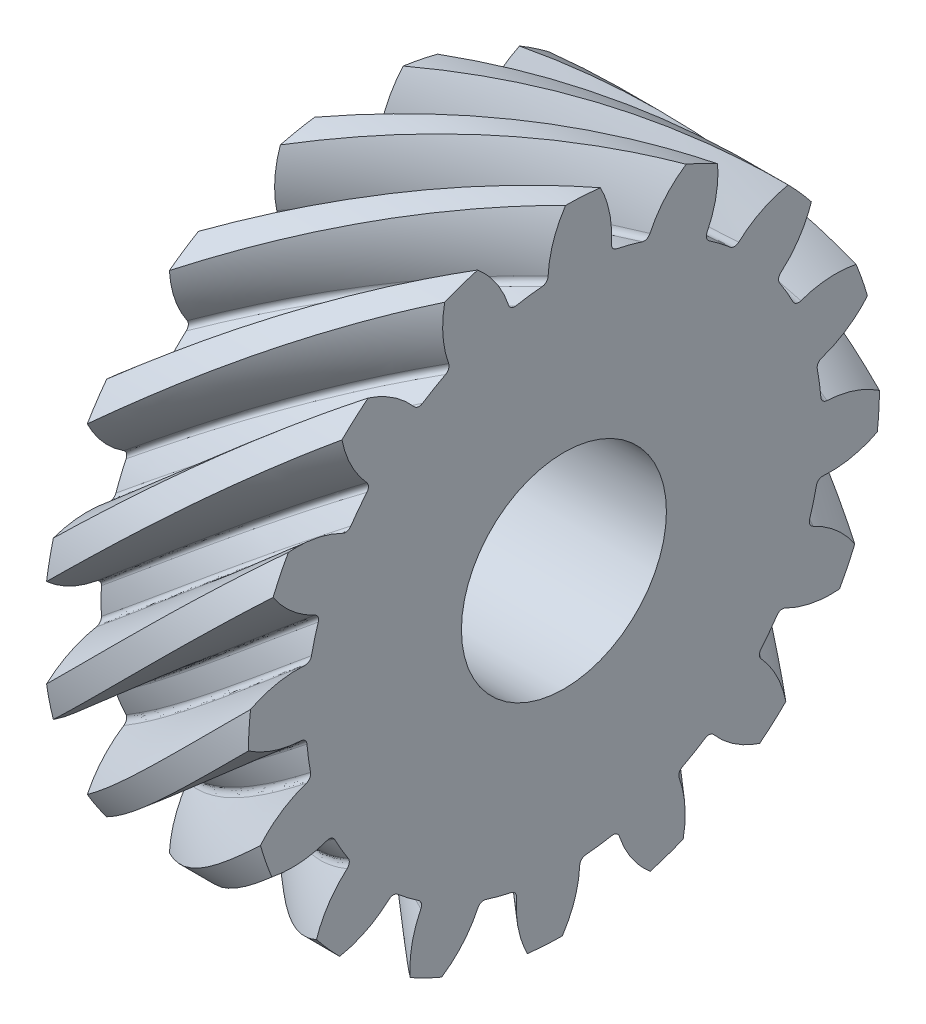
from build123d import *

# Parameters (mm, degrees)
BASPROSKE_W            = 12.7
BASPROSKE_H            = 19.548012242
TOOTHCUTLH_PITCH       = 122.823783304
TOOTHCUTLH_HEIGHT      = 12.7
TOOTHCUTLH_RADIUS      = 19.548012242
TOOTHCUTLH_START_ANGLE = -90
TEETHCUTSLH_COUNT      = 16
TEETHCUTSLH_ANGLE      = 337.5
BORSKE_R               = 6.35
BORE_DEPTH             = 50.8000508


with BuildPart() as part:
    # BasProSke → Base-Revolve (revolve)
    with BuildSketch(Plane(origin=(0, 0, 0), x_dir=(1, 0, 0), z_dir=(0, 1, 0)), mode=Mode.PRIVATE) as base_revolve_sk:
        with Locations((6.35, 9.774006121)):
            Rectangle(BASPROSKE_W, BASPROSKE_H)
    revolve(base_revolve_sk.sketch.rotate(Axis((-10, 0, 0), (1, 0, 0)), 180), axis=Axis((-10, 0, 0), (1, 0, 0)))

    # ToothCutLH: sweep along a helix
    with BuildLine() as toothcutlh_path:
        add(Helix(TOOTHCUTLH_PITCH, TOOTHCUTLH_HEIGHT, TOOTHCUTLH_RADIUS, center=(0, 0, 0), direction=(1, 0, 0), lefthand=True, mode=Mode.PRIVATE).rotate(Axis((0, 0, 0), (1, 0, 0)), TOOTHCUTLH_START_ANGLE))
    # TooCutSkeRH<3> → ToothCutLH (sweep, cut)
    with BuildSketch(Plane(origin=(0, 0, 0), x_dir=(0, 0, -1), z_dir=(1, 0, 0))):
        with BuildLine():
            ThreePointArc((0.823755872, 15.954886005), (0, 15.976137242), (-0.823755872, 15.954886005))
            ThreePointArc((-0.823755872, 15.954886005), (-1.090810557, 16.039860178), (-1.23572354, 16.279733149))
            ThreePointArc((-1.23572354, 16.279733149), (-1.950327029, 18.243075774), (-3.26344717, 19.8682182))
            ThreePointArc((-3.26344717, 19.8682182), (0, 20.134452609), (3.26344717, 19.8682182))
            ThreePointArc((3.26344717, 19.8682182), (1.950327029, 18.243075774), (1.23572354, 16.279733149))
            ThreePointArc((1.23572354, 16.279733149), (1.090810557, 16.039860178), (0.823755872, 15.954886005))
        make_face()
    toothcutlh = sweep(path=toothcutlh_path.line, is_frenet=True, mode=Mode.SUBTRACT)

    # TeethCutsLH: ToothCutLH ×16 about axis
    teethcutslh_axis = Axis((-10, 0, 0), (1, 0, 0))
    for i in range(1, TEETHCUTSLH_COUNT):
        add(toothcutlh.rotate(teethcutslh_axis, i * TEETHCUTSLH_ANGLE / (TEETHCUTSLH_COUNT - 1)), mode=Mode.SUBTRACT)

    # BorSke → Bore (cut, symmetric)
    with BuildSketch(Plane(origin=(0, 0, 0), x_dir=(0, 0, -1), z_dir=(1, 0, 0))):
        with Locations(Location((0, 0, 0), (0, 0, 180))):
            Circle(BORSKE_R)
    extrude(amount=BORE_DEPTH, both=True, mode=Mode.SUBTRACT)


solid = part.part
